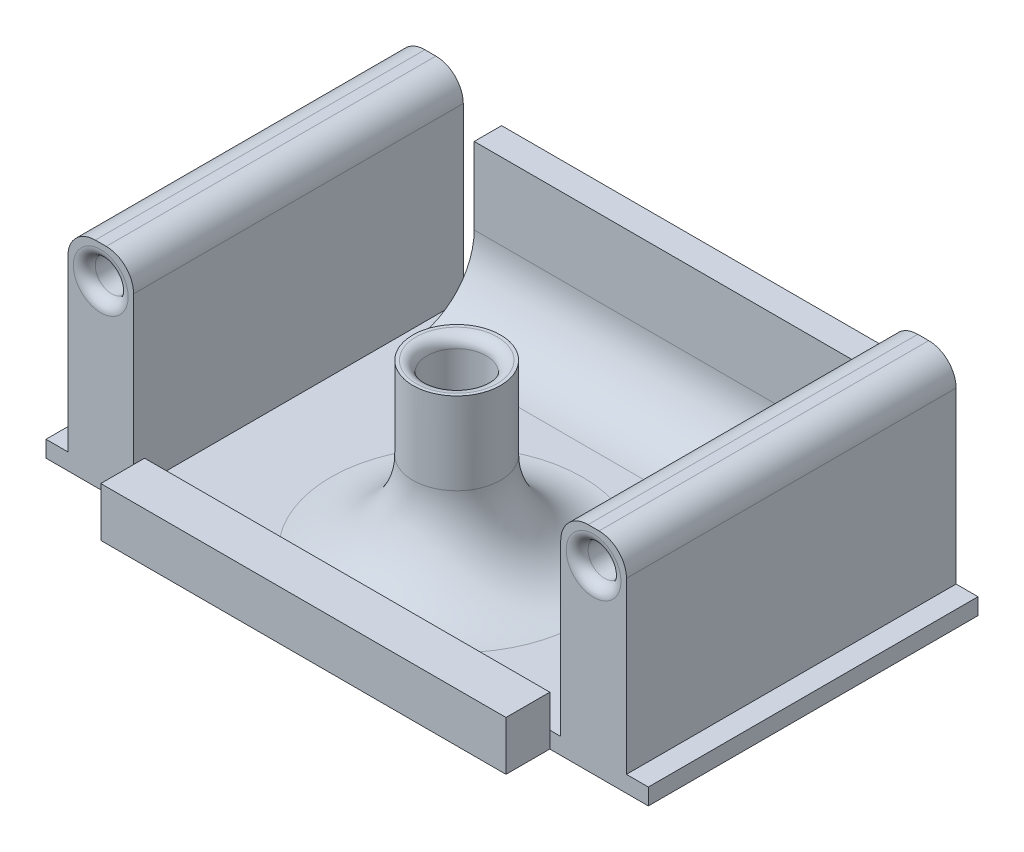
from build123d import *

# Parameters (mm, degrees)
SKETCH_1_W          = 110
SKETCH_1_H          = 60.2
EXTRUDE_1_DEPTH     = 4
SKETCH_2_W          = 12
SKETCH_2_H          = 60.2
EXTRUDE_2_DEPTH     = 36
SKETCH_4_R          = 3
CUT_EXTRUDE_1_DEPTH = 91.824225843
FILLET_1_R          = 5
SKETCH_5_R          = 8
EXTRUDE_3_DEPTH     = 30
SKETCH_6_R          = 5.4
CUT_EXTRUDE_2_DEPTH = 72.323278108
FILLET_3_R          = 2
SKETCH_8_W          = 74
SKETCH_8_H          = 5
EXTRUDE_4_DEPTH     = 30
SKETCH_8_3_W        = 74
SKETCH_8_3_H        = 8
EXTRUDE_5_DEPTH     = 10
CHAMFER_2_SIZE      = 1
FILLET_5_R          = 2
FILLET_6_R          = 12
FILLET_2_R          = 15


with BuildPart() as part:
    # Эскиз1 → Бобышка-Вытянуть1 (new body)
    with BuildSketch(Plane(origin=(0, 0, 0), x_dir=(1, 0, 0), z_dir=(0, 1, 0))):
        Rectangle(SKETCH_1_W, SKETCH_1_H)
    extrude(amount=EXTRUDE_1_DEPTH)

    # Эскиз2 → Бобышка-Вытянуть2 (add)
    with BuildSketch(Plane(origin=(0, 4, 0), x_dir=(1, 0, 0), z_dir=(0, 1, 0))):
        with Locations((-45, 0)):
            Rectangle(SKETCH_2_W, SKETCH_2_H)
        with Locations((45, 0)):
            Rectangle(SKETCH_2_W, SKETCH_2_H)
    extrude(amount=EXTRUDE_2_DEPTH)

    # Эскиз4 → Вырез-Вытянуть1 (cut, through all)
    with BuildSketch(Plane.XY.offset(30.1)):
        with Locations((-45, 34)):
            Circle(SKETCH_4_R)
        with Locations(Location((45, 34, 0), (0, 0, 180))):
            Circle(SKETCH_4_R)
    extrude(amount=-CUT_EXTRUDE_1_DEPTH, mode=Mode.SUBTRACT)

    # Скругление1
    fillet_1_edges = [part.edges().sort_by_distance(p)[0] for p in [
        (-39, 40, 0),
        (-51, 40, 0),
        (51, 40, 0),
        (39, 40, 0),
    ]]
    fillet(fillet_1_edges, radius=FILLET_1_R)

    # Эскиз5 → Бобышка-Вытянуть3 (add)
    with BuildSketch(Plane(origin=(0, 4, 0), x_dir=(1, 0, 0), z_dir=(0, 1, 0))):
        with Locations(Location((0, -10.1, 0), (0, 0, 90))):
            Circle(SKETCH_5_R)
    extrude(amount=EXTRUDE_3_DEPTH)

    # Эскиз6 → Вырез-Вытянуть2 (cut, through all)
    with BuildSketch(Plane(origin=(0, 34, 0), x_dir=(1, 0, 0), z_dir=(0, 1, 0))):
        with Locations(Location((0, -10.1, 0), (0, 0, 270))):
            Circle(SKETCH_6_R)
    extrude(amount=-CUT_EXTRUDE_2_DEPTH, mode=Mode.SUBTRACT)

    # Скругление3
    fillet_3_edges = [part.edges().sort_by_distance(p)[0] for p in [
        (0, 34, 4.7),
    ]]
    fillet(fillet_3_edges, radius=FILLET_3_R)

    # Эскиз8 → Бобышка-Вытянуть4 (add)
    with BuildSketch(Plane(origin=(0, 0, 0), x_dir=(1, 0, 0), z_dir=(0, 1, 0))):
        with Locations((0, 32.6)):
            Rectangle(SKETCH_8_W, SKETCH_8_H)
    extrude(amount=EXTRUDE_4_DEPTH)

    # Эскиз8<3> → Бобышка-Вытянуть5 (add)
    with BuildSketch(Plane(origin=(0, 0, 0), x_dir=(1, 0, 0), z_dir=(0, 1, 0))):
        with Locations((0, -34.1)):
            Rectangle(SKETCH_8_3_W, SKETCH_8_3_H)
    extrude(amount=EXTRUDE_5_DEPTH)

    # Фаска2
    chamfer_2_edges = [part.edges().sort_by_distance(p)[0] for p in [
        (46, 0, 30.1),
        (-37, 0, 34.1),
        (0, 0, 38.1),
        (37, 0, 34.1),
        (-46, 0, 30.1),
        (-55, 0, 0),
        (46, 0, -30.1),
        (55, 0, 0),
        (0, 0, 4.7),
        (-46, 0, -30.1),
        (37, 0, -32.6),
        (-37, 0, -32.6),
        (0, 0, -35.1),
    ]]
    chamfer(chamfer_2_edges, length=CHAMFER_2_SIZE)

    # Скругление5
    fillet_5_edges = [part.edges().sort_by_distance(p)[0] for p in [
        (-48, 34, -30.1),
        (-48, 34, 30.1),
        (48, 34, -30.1),
        (48, 34, 30.1),
    ]]
    fillet(fillet_5_edges, radius=FILLET_5_R)

    # Скругление6
    fillet_6_edges = [part.edges().sort_by_distance(p)[0] for p in [
        (0, 4, -30.1),
    ]]
    fillet(fillet_6_edges, radius=FILLET_6_R)

    # Скругление2
    # the kernel refuses this fillet: 15 mm, written as the material it adds along each edge
    with BuildSketch(Plane(origin=(0, 4, 10.1), x_dir=(0, 0, -1), z_dir=(1, 0, 0))) as fillet_2_piece_1:
        with BuildLine():
            CenterArc((8 + FILLET_2_R, FILLET_2_R), FILLET_2_R, 180, 90)
            Line((8, FILLET_2_R), (8, 0))
            Line((8, 0), (8 + FILLET_2_R, 0))
        make_face()
    revolve(axis=Axis((0, 4, 10.1), (0, 1, 0)))


solid = part.part
